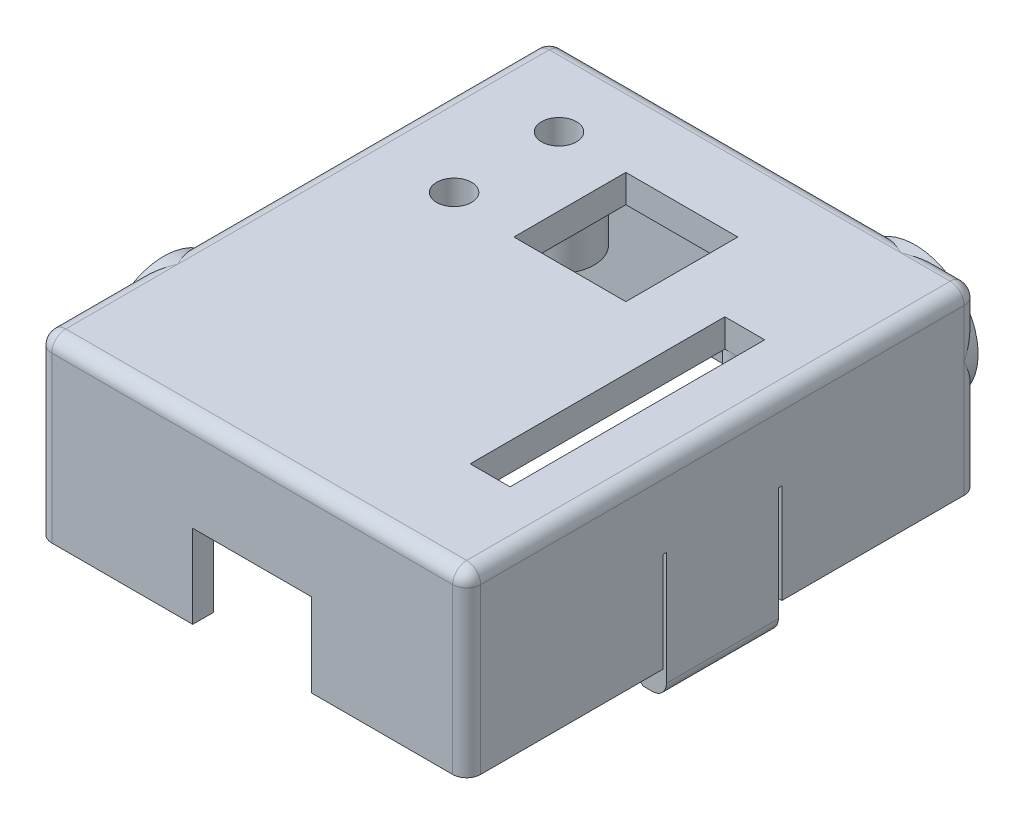
from build123d import *

# Parameters (mm, degrees)
BOTTOM_DEPTH         = 6.6
BOTTOM_2_DEPTH       = 6.6
BOTTOM_3_DEPTH       = 6.6
SKETCH2_R            = 1.5
SIDES_DEPTH          = 7.65
SIDES_2_DEPTH        = 7.65
SIDES_3_DEPTH        = 7.65
SIDES_4_DEPTH        = 7.65
SIDES_5_DEPTH        = 7.65
SKETCH3_W            = 30.65
SKETCH3_H            = 36.55
SKETCH3_W_2          = 8
SKETCH3_H_2          = 8
TOP_DEPTH            = 2
TAB_EXTRUDE_DEPTH    = 4
SKETCH6_W            = 8.5
SKETCH6_H            = 4.8
PORT_TOP_DEPTH       = 1.475
SKETCH18_R           = 1.25
BUTTON_CUT_DEPTH     = 10
SKETCH25_R           = 2.505
SKETCH25_R_2         = 1.75
BUTTON_HOLDERS_DEPTH = 5
FILLET1_R            = 1
SKETCH19_R           = 4.5
BOSS_EXTRUDE8_DEPTH  = 8
SKETCH20_R           = 2.3749
CUT_EXTRUDE4_DEPTH   = 6
BOSS_EXTRUDE9_START  = -2
SKETCH23_R           = 4.5
BOSS_EXTRUDE9_DEPTH  = 2
THREAD3_PITCH        = 1.27
SKETCH7_R            = 4.5
BOSS_EXTRUDE6_DEPTH  = 8
SKETCH8_R            = 2.3749
CUT_EXTRUDE1_DEPTH   = 6
THREAD1_PITCH        = 1.27
BOSS_EXTRUDE7_START  = -2
SKETCH17_R           = 4.5
BOSS_EXTRUDE7_DEPTH  = 2
SKETCH24_W           = 2.85
SKETCH24_H           = 18.2
HEAD_CUT_DEPTH       = 28.044292498
SKETCH26_R           = 1
BOSS_EXTRUDE10_DEPTH = 1.6
SKETCH27_W           = 0.25
SKETCH27_H           = 4
CUT_EXTRUDE5_DEPTH   = 38.183338162


with BuildPart() as part:
    # Sketch1 → bottom (new body)
    with BuildSketch(Plane(origin=(0, -2.3, 0), x_dir=(1, 0, 0), z_dir=(0, 1, 0))):
        Polygon((-15.325, 4.25), (-13.35, 4.25), (-13.35, 16.8), (13.35, 16.8), (13.35, 4.25), (15.325, 4.25), (15.325, 18.275), (-15.325, 18.275), align=None)
    extrude(amount=BOTTOM_DEPTH)


with BuildPart() as body_2:
    # Sketch1 → bottom 2 (new body)
    with BuildSketch(Plane(origin=(0, -2.3, 0), x_dir=(1, 0, 0), z_dir=(0, 1, 0))):
        Polygon((15.325, -18.275), (4.25, -18.275), (4.25, -16.8), (13.35, -16.8), (13.35, -4.25), (15.325, -4.25), align=None)
    extrude(amount=BOTTOM_2_DEPTH)


with BuildPart() as body_3:
    # Sketch1 → bottom 3 (new body)
    with BuildSketch(Plane(origin=(0, -2.3, 0), x_dir=(1, 0, 0), z_dir=(0, 1, 0))):
        Polygon((-13.35, -4.25), (-15.325, -4.25), (-15.325, -18.275), (-4.25, -18.275), (-4.25, -16.8), (-13.35, -16.8), align=None)
    extrude(amount=BOTTOM_3_DEPTH)


with BuildPart() as body_4:
    # Sketch2 → sides (new body)
    with BuildSketch(Plane(origin=(0, 0.8, 0), x_dir=(1, 0, 0), z_dir=(0, 1, 0))):
        with Locations(Location((-8.9, 8.55, 0), (0, 0, 90))):
            Circle(SKETCH2_R)
    extrude(amount=SIDES_DEPTH)


with BuildPart() as body_5:
    # Sketch2 → sides 2 (new body)
    with BuildSketch(Plane(origin=(0, 0.8, 0), x_dir=(1, 0, 0), z_dir=(0, 1, 0))):
        with Locations(Location((8.9, 8.55, 0), (0, 0, 90))):
            Circle(SKETCH2_R)
    extrude(amount=SIDES_2_DEPTH)


with BuildPart() as body_6:
    # Sketch2 → sides 3 (new body)
    with BuildSketch(Plane(origin=(0, 0.8, 0), x_dir=(1, 0, 0), z_dir=(0, 1, 0))):
        with Locations(Location((8.9, -13.05, 0), (0, 0, 90))):
            Circle(SKETCH2_R)
    extrude(amount=SIDES_3_DEPTH)


with BuildPart() as body_7:
    # Sketch2 → sides 4 (new body)
    with BuildSketch(Plane(origin=(0, 0.8, 0), x_dir=(1, 0, 0), z_dir=(0, 1, 0))):
        with Locations(Location((-8.9, -13.05, 0), (0, 0, 90))):
            Circle(SKETCH2_R)
    extrude(amount=SIDES_4_DEPTH)


with BuildPart() as body_8:
    # Sketch2 → sides 5 (new body)
    with BuildSketch(Plane(origin=(0, 0.8, 0), x_dir=(1, 0, 0), z_dir=(0, 1, 0))):
        Polygon((-15.325, 18.275), (15.325, 18.275), (15.325, -18.275), (4.25, -18.275), (4.25, -16.8), (13.35, -16.8), (13.35, 16.8), (-13.35, 16.8), (-13.35, -16.8), (-4.25, -16.8), (-4.25, -18.275), (-15.325, -18.275), align=None)
    extrude(amount=SIDES_5_DEPTH)


with BuildPart() as body_9:
    # Sketch3 → top (new body)
    with BuildSketch(Plane(origin=(0, 8.45, 0), x_dir=(1, 0, 0), z_dir=(0, 1, 0))):
        Rectangle(SKETCH3_W, SKETCH3_H)
        with Locations((0, 8.425)):
            Rectangle(SKETCH3_W_2, SKETCH3_H_2, mode=Mode.SUBTRACT)
    extrude(amount=TOP_DEPTH)


with BuildPart() as part_1:
    add(part.part)

    # Combine1: union body 9, body 7, body 6, body 4, body 5, body 3, body 2, body 8
    add(body_9.part)
    add(body_7.part)
    add(body_6.part)
    add(body_4.part)
    add(body_5.part)
    add(body_3.part)
    add(body_2.part)
    add(body_8.part)

    # Sketch5 → tab extrude (add, symmetric)
    with BuildSketch(Plane.XY):
        Polygon((-15.325, 0.8), (-15.325, -4.3), (-13.65, -4.3), (-12.45, -3.1), (-12.45, -2.2), (-13.35, -2.3), (-13.35, 0.8), align=None)
    tab_extrude = extrude(amount=TAB_EXTRUDE_DEPTH, both=True)

    # tab mirror: tab extrude across plane
    add(tab_extrude.mirror(Plane(origin=(0, 0, 0), x_dir=(0, 0, 1), z_dir=(1, 0, 0))))

    # Sketch6 → port top (add)
    with BuildSketch(Plane.XY.offset(18.275)):
        with Locations((0, 6.05)):
            Rectangle(SKETCH6_W, SKETCH6_H)
    extrude(amount=-PORT_TOP_DEPTH)

    # Sketch18 → button cut (cut)
    with BuildSketch(Plane(origin=(0, 8.45, 0), x_dir=(-1, 0, 0), z_dir=(0, -1, 0))):
        with Locations(Location((8.9, 5.05, 0), (0, 0, 90))):
            Circle(SKETCH18_R)
        with Locations(Location((8.9, 12.55, 0), (0, 0, 90))):
            Circle(SKETCH18_R)
    extrude(amount=-BUTTON_CUT_DEPTH, mode=Mode.SUBTRACT)

    # Sketch25 → button holders (add)
    # profile 1 of 2: a face of its own
    with BuildSketch(Plane.XZ.offset(-8.45)):
        with Locations((-8.9, -5.05)):
            Circle(SKETCH25_R)
        with Locations(Location((-8.9, -5.05, 0), (0, 0, 270))):
            Circle(SKETCH25_R_2, mode=Mode.SUBTRACT)
    # profile 2 of 2: a face of its own
    with BuildSketch(Plane.XZ.offset(-8.45)):
        with Locations((-8.9, -12.55)):
            Circle(SKETCH25_R)
        with Locations(Location((-8.9, -12.55, 0), (0, 0, 270))):
            Circle(SKETCH25_R_2, mode=Mode.SUBTRACT)
    extrude(amount=BUTTON_HOLDERS_DEPTH)

    # Fillet1
    fillet1_edges = [part_1.edges().sort_by_distance(p)[0] for p in [
        (15.325, -4.3, 0),
        (-15.325, 4.075, -18.275),
        (-15.325, 10.45, 0),
        (0, 10.45, 18.275),
        (15.325, 10.45, 0),
        (0, 10.45, -18.275),
        (-15.325, 4.075, 18.275),
        (15.325, 4.075, 18.275),
        (15.325, 4.075, -18.275),
        (-15.325, -4.3, 0),
    ]]
    fillet(fillet1_edges, radius=FILLET1_R)

    # Sketch19 → Boss-Extrude8 (add)
    with BuildSketch(Plane(origin=(0, 0, -18.275), x_dir=(-1, 0, 0), z_dir=(0, 0, -1))):
        with Locations((-10.825, 5.95)):
            Circle(SKETCH19_R)
    extrude(amount=-BOSS_EXTRUDE8_DEPTH)

    # Sketch20 → Cut-Extrude4 (cut)
    with BuildSketch(Plane(origin=(0, 0, -18.275), x_dir=(-1, 0, 0), z_dir=(0, 0, -1))):
        with Locations((-10.825, 5.95)):
            Circle(SKETCH20_R)
    extrude(amount=-CUT_EXTRUDE4_DEPTH, mode=Mode.SUBTRACT)

    # Sketch23 → Boss-Extrude9 (add)
    with BuildSketch(Plane.XY.offset(-10.275).offset(BOSS_EXTRUDE9_START)):
        with Locations((10.825, 5.95)):
            Circle(SKETCH23_R)
    extrude(amount=BOSS_EXTRUDE9_DEPTH)

    # Thread3: the profile of Thread Profile3 profile screwed along a right-hand helix of 5.511811 turns, 8 arcs to a turn; built about Z, then put on its axis
    thread3_z = Axis((0, 0, 0), (0, 0, 1))
    thread3_corners = [(2.3746, 0, -0.000173205), (3.062307661, 0, 0.396874998), (3.062307661, 0, 0.555624998), (2.3746, 0, 0.952673202)]
    with BuildLine(mode=Mode.PRIVATE) as thread3_profile:
        Line(thread3_corners[0], thread3_corners[1])
        Line(thread3_corners[1], thread3_corners[2])
        Line(thread3_corners[2], thread3_corners[3])
        Line(thread3_corners[3], thread3_corners[0])
    thread3_cap = Face(thread3_profile.wire())
    thread3_turn_angles = [0, 22.5, 45, 67.5, 90, 112.5, 135, 157.5, 180, 202.5, 225, 247.5, 270, 292.5, 315, 337.5, 360]
    thread3_turn_weights = [1, 0.9238795325112867, 1, 0.9238795325112867, 1, 0.9238795325112867, 1, 0.9238795325112867, 1, 0.9238795325112867, 1, 0.9238795325112867, 1, 0.9238795325112867, 1, 0.9238795325112867, 1]
    thread3_turn_rails = [Edge.make_bspline([Vector(p[0], p[1], 0).rotate(thread3_z, thread3_turn_angles[k]) / thread3_turn_weights[k] + Vector(0, 0, p[2] + THREAD3_PITCH * thread3_turn_angles[k] / 360) for k in range(17)], [0, 0, 0, 1, 1, 2, 2, 3, 3, 4, 4, 5, 5, 6, 6, 7, 7, 8, 8, 8], 2, thread3_turn_weights) for p in thread3_corners]
    thread3_turn_sides = [Face.make_surface_from_curves(thread3_turn_rails[p[0]], thread3_turn_rails[p[1]]) for p in [(0, 1), (1, 2), (2, 3), (3, 0)]]
    thread3_last_angles = [1800, 1822.5, 1845, 1867.5, 1890, 1912.5, 1935, 1957.5, 1980, 1982.125984252, 1984.251968504]
    thread3_last_weights = [1, 0.9238795325112867, 1, 0.9238795325112867, 1, 0.9238795325112867, 1, 0.9238795325112867, 1, 0.9993116726964552, 1]
    thread3_last_rails = [Edge.make_bspline([Vector(p[0], p[1], 0).rotate(thread3_z, thread3_last_angles[k]) / thread3_last_weights[k] + Vector(0, 0, p[2] + THREAD3_PITCH * thread3_last_angles[k] / 360) for k in range(11)], [0, 0, 0, 1, 1, 2, 2, 3, 3, 4, 4, 5, 5, 5], 2, thread3_last_weights) for p in thread3_corners]
    thread3_last_sides = [Face.make_surface_from_curves(thread3_last_rails[p[0]], thread3_last_rails[p[1]]) for p in [(0, 1), (1, 2), (2, 3), (3, 0)]]
    thread3 = Plane(origin=(10.825, 5.95, -19.275), x_dir=(1, 0, 0), z_dir=(0, 0, 1)) * Solid(Shell([*[p.moved(Location((0, 0, THREAD3_PITCH * i))) for i in range(5) for p in thread3_turn_sides], *thread3_last_sides, thread3_cap, thread3_cap.rotate(thread3_z, 1984.251968504).moved(Location((0, 0, THREAD3_PITCH * 1984.251968504 / 360)))]))
    add(thread3, mode=Mode.SUBTRACT)

    # Sketch7 → Boss-Extrude6 (add)
    with BuildSketch(Plane(origin=(-15.325, -4.875, 0), x_dir=(0, -1, 0), z_dir=(1, 0, 0))):
        with Locations((-10.825, -9.275)):
            Circle(SKETCH7_R)
    extrude(amount=BOSS_EXTRUDE6_DEPTH)

    # Sketch8 → Cut-Extrude1 (cut)
    with BuildSketch(Plane(origin=(-15.325, -4.875, 0), x_dir=(0, -1, 0), z_dir=(1, 0, 0))):
        with Locations(Location((-10.825, -9.275, 0), (0, 0, 90))):
            Circle(SKETCH8_R)
    extrude(amount=CUT_EXTRUDE1_DEPTH, mode=Mode.SUBTRACT)

    # Thread1: the profile of Thread Profile1 profile screwed along a right-hand helix of 5.511811 turns, 8 arcs to a turn; built about Z, then put on its axis
    thread1_z = Axis((0, 0, 0), (0, 0, 1))
    thread1_corners = [(2.3746, 0, -0.000173205), (3.062307661, 0, 0.396874998), (3.062307661, 0, 0.555624998), (2.3746, 0, 0.952673202)]
    with BuildLine(mode=Mode.PRIVATE) as thread1_profile:
        Line(thread1_corners[0], thread1_corners[1])
        Line(thread1_corners[1], thread1_corners[2])
        Line(thread1_corners[2], thread1_corners[3])
        Line(thread1_corners[3], thread1_corners[0])
    thread1_cap = Face(thread1_profile.wire())
    thread1_turn_angles = [0, 22.5, 45, 67.5, 90, 112.5, 135, 157.5, 180, 202.5, 225, 247.5, 270, 292.5, 315, 337.5, 360]
    thread1_turn_weights = [1, 0.9238795325112867, 1, 0.9238795325112867, 1, 0.9238795325112867, 1, 0.9238795325112867, 1, 0.9238795325112867, 1, 0.9238795325112867, 1, 0.9238795325112867, 1, 0.9238795325112867, 1]
    thread1_turn_rails = [Edge.make_bspline([Vector(p[0], p[1], 0).rotate(thread1_z, thread1_turn_angles[k]) / thread1_turn_weights[k] + Vector(0, 0, p[2] + THREAD1_PITCH * thread1_turn_angles[k] / 360) for k in range(17)], [0, 0, 0, 1, 1, 2, 2, 3, 3, 4, 4, 5, 5, 6, 6, 7, 7, 8, 8, 8], 2, thread1_turn_weights) for p in thread1_corners]
    thread1_turn_sides = [Face.make_surface_from_curves(thread1_turn_rails[p[0]], thread1_turn_rails[p[1]]) for p in [(0, 1), (1, 2), (2, 3), (3, 0)]]
    thread1_last_angles = [1800, 1822.5, 1845, 1867.5, 1890, 1912.5, 1935, 1957.5, 1980, 1982.125984252, 1984.251968504]
    thread1_last_weights = [1, 0.9238795325112867, 1, 0.9238795325112867, 1, 0.9238795325112867, 1, 0.9238795325112867, 1, 0.9993116726964554, 1]
    thread1_last_rails = [Edge.make_bspline([Vector(p[0], p[1], 0).rotate(thread1_z, thread1_last_angles[k]) / thread1_last_weights[k] + Vector(0, 0, p[2] + THREAD1_PITCH * thread1_last_angles[k] / 360) for k in range(11)], [0, 0, 0, 1, 1, 2, 2, 3, 3, 4, 4, 5, 5, 5], 2, thread1_last_weights) for p in thread1_corners]
    thread1_last_sides = [Face.make_surface_from_curves(thread1_last_rails[p[0]], thread1_last_rails[p[1]]) for p in [(0, 1), (1, 2), (2, 3), (3, 0)]]
    thread1 = Plane(origin=(-16.325, 5.95, 9.275), x_dir=(0, 0, -1), z_dir=(1, 0, 0)) * Solid(Shell([*[p.moved(Location((0, 0, THREAD1_PITCH * i))) for i in range(5) for p in thread1_turn_sides], *thread1_last_sides, thread1_cap, thread1_cap.rotate(thread1_z, 1984.251968504).moved(Location((0, 0, THREAD1_PITCH * 1984.251968504 / 360)))]))
    add(thread1, mode=Mode.SUBTRACT)

    # Sketch17 → Boss-Extrude7 (add)
    with BuildSketch(Plane(origin=(-7.325, 0, 0), x_dir=(0, 0, -1), z_dir=(1, 0, 0)).offset(BOSS_EXTRUDE7_START)):
        with Locations((-9.275, 5.95)):
            Circle(SKETCH17_R)
    extrude(amount=BOSS_EXTRUDE7_DEPTH)

    # Sketch24 → head cut (cut, through all)
    with BuildSketch(Plane.XZ.offset(-8.45)):
        with Locations((9.9, 2.075)):
            Rectangle(SKETCH24_W, SKETCH24_H)
    extrude(amount=-HEAD_CUT_DEPTH, mode=Mode.SUBTRACT)

    # Sketch26 → Boss-Extrude10 (add)
    with BuildSketch(Plane.XZ.offset(-0.8)):
        with Locations(Location((-8.9, -8.55, 0), (0, 0, 270))):
            Circle(SKETCH26_R)
        with Locations(Location((-8.9, 13.05, 0), (0, 0, 270))):
            Circle(SKETCH26_R)
        with Locations(Location((8.9, 13.05, 0), (0, 0, 270))):
            Circle(SKETCH26_R)
        with Locations(Location((8.9, -8.55, 0), (0, 0, 270))):
            Circle(SKETCH26_R)
    extrude(amount=BOSS_EXTRUDE10_DEPTH)

    # Sketch27 → Cut-Extrude5 (cut, through all)
    with BuildSketch(Plane.ZY.offset(15.325)):
        with Locations((-4.125, 2.8)):
            Rectangle(SKETCH27_W, SKETCH27_H)
        with Locations((4.125, 2.8)):
            Rectangle(SKETCH27_W, SKETCH27_H)
    extrude(amount=-CUT_EXTRUDE5_DEPTH, mode=Mode.SUBTRACT)


solid = part_1.part
